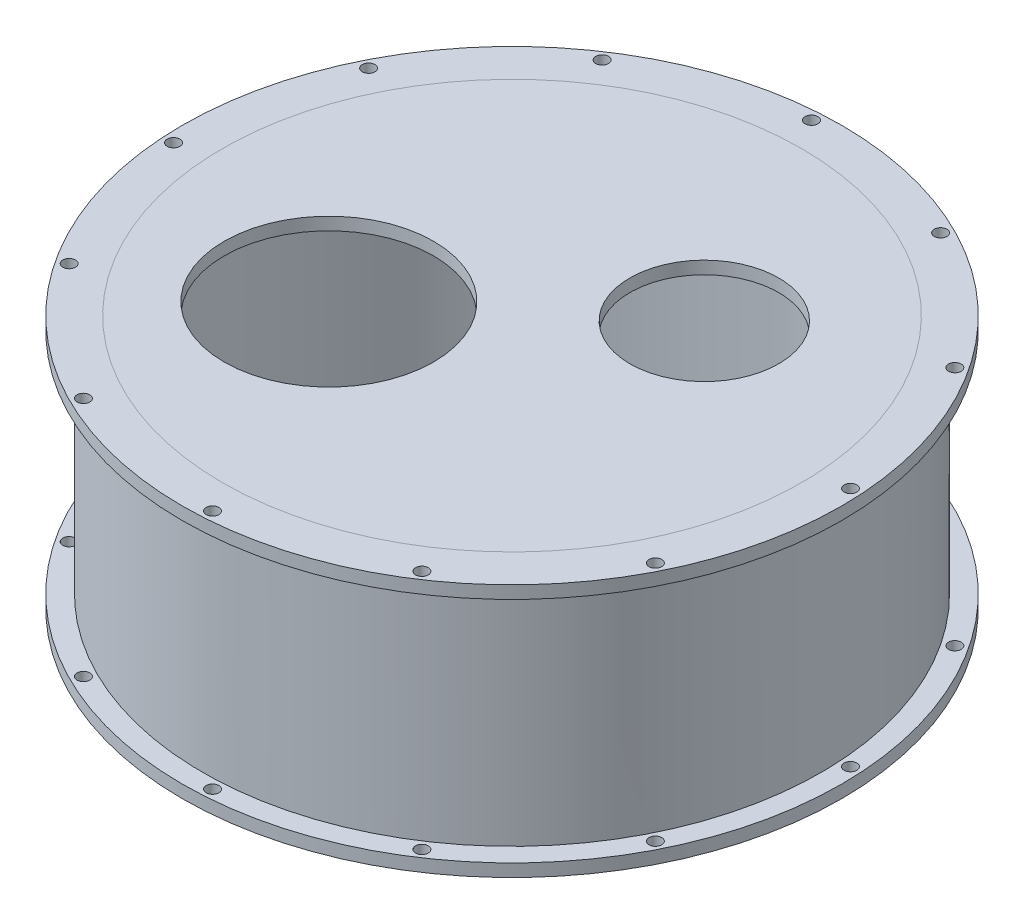
from build123d import *

# Parameters (mm, degrees)
SKETCH1_R           = 155
SKETCH1_R_2         = 145
BOSS_EXTRUDE1_DEPTH = 63.5
SKETCH2_R           = 165.16
SKETCH2_R_2         = 155
BOSS_EXTRUDE2_DEPTH = 6.35
SKETCH3_R           = 145
SKETCH3_R_2         = 37.277426073
SKETCH3_R_3         = 52.443744705
BOSS_EXTRUDE4_DEPTH = 6.35
CIRPATTERN2_COUNT   = 12


with BuildPart() as part:
    # Sketch1 → Boss-Extrude1 (new body)
    with BuildSketch(Plane(origin=(0, 0, 0), x_dir=(1, 0, 0), z_dir=(0, 1, 0))):
        Circle(SKETCH1_R)
        Circle(SKETCH1_R_2, mode=Mode.SUBTRACT)
    boss_extrude1 = extrude(amount=BOSS_EXTRUDE1_DEPTH)

    # Sketch2 → Boss-Extrude2 (add)
    with BuildSketch(Plane.XZ):
        Circle(SKETCH2_R)
        Circle(SKETCH2_R_2, mode=Mode.SUBTRACT)
    boss_extrude2 = extrude(amount=-BOSS_EXTRUDE2_DEPTH)

    # Mirror2: Boss-Extrude1, Boss-Extrude2 across plane
    add(boss_extrude1.mirror(Plane.ZX.offset(63.5)))
    add(boss_extrude2.mirror(Plane.ZX.offset(63.5)))

    # Sketch10 → 1/4 (0.25) Diameter Hole2 (revolve, cut)
    with BuildSketch(Plane(origin=(9.767093679, 127, 159.781758286), x_dir=(0, 0, 1), z_dir=(1, 0, 0))):
        Polygon((0, 0), (0, 8.257732465), (3.175, 6.35), (3.175, 0), align=None)
    f_1_4_0_25_diameter_hole2 = revolve(axis=Axis((9.767093679, 133.35, 159.781758286), (0, -1, 0)), mode=Mode.SUBTRACT)

    # Mirror6: 1/4 (0.25) Diameter Hole2 across plane
    add(f_1_4_0_25_diameter_hole2.mirror(Plane.ZX.offset(63.5)), mode=Mode.SUBTRACT)

    # CirPattern2: 1/4 (0.25) Diameter Hole2 ×12 about axis
    cirpattern2_axis = Axis((0, 0, 0), (0, 1, 0))
    for i in range(1, CIRPATTERN2_COUNT):
        add(f_1_4_0_25_diameter_hole2.rotate(cirpattern2_axis, i * 360 / CIRPATTERN2_COUNT), mode=Mode.SUBTRACT)

    # CirPattern2 copy 1 sketch → CirPattern2 copy 1 (revolve, cut)
    with BuildSketch(Plane(origin=(88.349430391, 0, 133.491514898), x_dir=(0.49999999999999994, 0, 0.8660254037844387), z_dir=(0.8660254037844387, 0, -0.49999999999999994))):
        Polygon((0, 0), (0, -8.257732465), (3.175, -6.35), (3.175, 0), align=None)
    revolve(axis=Axis((88.349430391, -6.35, 133.491514898), (0, -1, 0)), mode=Mode.SUBTRACT)

    # CirPattern2 copy 2 sketch → CirPattern2 copy 2 (revolve, cut)
    with BuildSketch(Plane(origin=(143.258608577, 0, 71.432327896), x_dir=(0.8660254037844386, 0, 0.5000000000000001), z_dir=(0.5000000000000001, 0, -0.8660254037844386))):
        Polygon((0, 0), (0, -8.257732465), (3.175, -6.35), (3.175, 0), align=None)
    revolve(axis=Axis((143.258608577, -6.35, 71.432327896), (0, -1, 0)), mode=Mode.SUBTRACT)

    # CirPattern2 copy 3 sketch → CirPattern2 copy 3 (revolve, cut)
    with BuildSketch(Plane(origin=(159.781758286, 0, -9.767093679), x_dir=(1, 0, 0), z_dir=(0, 0, -1))):
        Polygon((0, 0), (0, -8.257732465), (3.175, -6.35), (3.175, 0), align=None)
    revolve(axis=Axis((159.781758286, -6.35, -9.767093679), (0, -1, 0)), mode=Mode.SUBTRACT)

    # CirPattern2 copy 4 sketch → CirPattern2 copy 4 (revolve, cut)
    with BuildSketch(Plane(origin=(133.491514898, 0, -88.349430391), x_dir=(0.8660254037844387, 0, -0.4999999999999998), z_dir=(-0.4999999999999998, 0, -0.8660254037844387))):
        Polygon((0, 0), (0, -8.257732465), (3.175, -6.35), (3.175, 0), align=None)
    revolve(axis=Axis((133.491514898, -6.35, -88.349430391), (0, -1, 0)), mode=Mode.SUBTRACT)

    # CirPattern2 copy 5 sketch → CirPattern2 copy 5 (revolve, cut)
    with BuildSketch(Plane(origin=(71.432327896, 0, -143.258608577), x_dir=(0.49999999999999994, 0, -0.8660254037844387), z_dir=(-0.8660254037844387, 0, -0.49999999999999994))):
        Polygon((0, 0), (0, -8.257732465), (3.175, -6.35), (3.175, 0), align=None)
    revolve(axis=Axis((71.432327896, -6.35, -143.258608577), (0, -1, 0)), mode=Mode.SUBTRACT)

    # CirPattern2 copy 6 sketch → CirPattern2 copy 6 (revolve, cut)
    with BuildSketch(Plane(origin=(-9.767093679, 0, -159.781758286), x_dir=(0, 0, -1), z_dir=(-1, 0, 0))):
        Polygon((0, 0), (0, -8.257732465), (3.175, -6.35), (3.175, 0), align=None)
    revolve(axis=Axis((-9.767093679, -6.35, -159.781758286), (0, -1, 0)), mode=Mode.SUBTRACT)

    # CirPattern2 copy 7 sketch → CirPattern2 copy 7 (revolve, cut)
    with BuildSketch(Plane(origin=(-88.349430391, 0, -133.491514898), x_dir=(-0.5000000000000001, 0, -0.8660254037844386), z_dir=(-0.8660254037844386, 0, 0.5000000000000001))):
        Polygon((0, 0), (0, -8.257732465), (3.175, -6.35), (3.175, 0), align=None)
    revolve(axis=Axis((-88.349430391, -6.35, -133.491514898), (0, -1, 0)), mode=Mode.SUBTRACT)

    # CirPattern2 copy 8 sketch → CirPattern2 copy 8 (revolve, cut)
    with BuildSketch(Plane(origin=(-143.258608577, 0, -71.432327896), x_dir=(-0.8660254037844384, 0, -0.5000000000000004), z_dir=(-0.5000000000000004, 0, 0.8660254037844384))):
        Polygon((0, 0), (0, -8.257732465), (3.175, -6.35), (3.175, 0), align=None)
    revolve(axis=Axis((-143.258608577, -6.35, -71.432327896), (0, -1, 0)), mode=Mode.SUBTRACT)

    # CirPattern2 copy 9 sketch → CirPattern2 copy 9 (revolve, cut)
    with BuildSketch(Plane(origin=(-159.781758286, 0, 9.767093679), x_dir=(-1, 0, 0), z_dir=(0, 0, 1))):
        Polygon((0, 0), (0, -8.257732465), (3.175, -6.35), (3.175, 0), align=None)
    revolve(axis=Axis((-159.781758286, -6.35, 9.767093679), (0, -1, 0)), mode=Mode.SUBTRACT)

    # CirPattern2 copy 10 sketch → CirPattern2 copy 10 (revolve, cut)
    with BuildSketch(Plane(origin=(-133.491514898, 0, 88.349430391), x_dir=(-0.8660254037844386, 0, 0.5000000000000001), z_dir=(0.5000000000000001, 0, 0.8660254037844386))):
        Polygon((0, 0), (0, -8.257732465), (3.175, -6.35), (3.175, 0), align=None)
    revolve(axis=Axis((-133.491514898, -6.35, 88.349430391), (0, -1, 0)), mode=Mode.SUBTRACT)

    # CirPattern2 copy 11 sketch → CirPattern2 copy 11 (revolve, cut)
    with BuildSketch(Plane(origin=(-71.432327896, 0, 143.258608577), x_dir=(-0.5000000000000004, 0, 0.8660254037844384), z_dir=(0.8660254037844384, 0, 0.5000000000000004))):
        Polygon((0, 0), (0, -8.257732465), (3.175, -6.35), (3.175, 0), align=None)
    revolve(axis=Axis((-71.432327896, -6.35, 143.258608577), (0, -1, 0)), mode=Mode.SUBTRACT)


with BuildPart() as body_2:
    # Sketch3 → Boss-Extrude4 (new body)
    with BuildSketch(Plane(origin=(0, 127, 0), x_dir=(1, 0, 0), z_dir=(0, 1, 0))):
        Circle(SKETCH3_R)
        with Locations((50.436816268, 45.895311145)):
            Circle(SKETCH3_R_2, mode=Mode.SUBTRACT)
        with Locations((-51.935843859, -39.800539592)):
            Circle(SKETCH3_R_3, mode=Mode.SUBTRACT)
    extrude(amount=-BOSS_EXTRUDE4_DEPTH)


solid = Compound([part.part, body_2.part])
